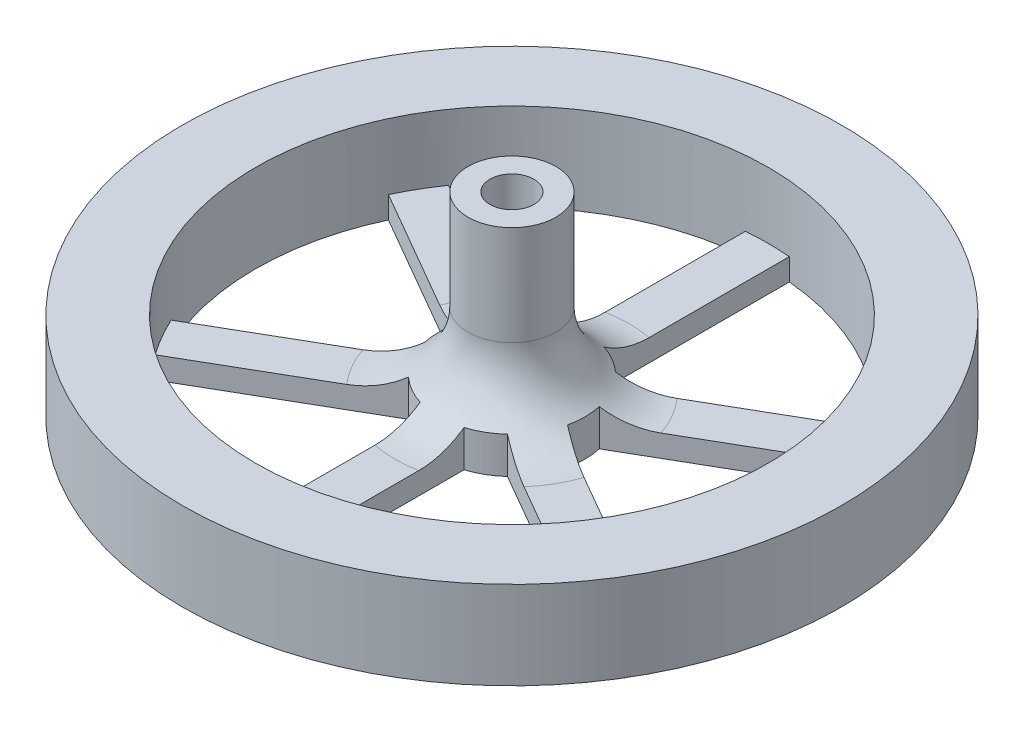
from build123d import *

# Parameters (mm, degrees)
SKETCH2_R           = 45
SKETCH2_R_2         = 35
BOSS_EXTRUDE1_DEPTH = 12
BOSS_EXTRUDE2_DEPTH = 3
CIRPATTERN1_COUNT   = 6
SKETCH4_R           = 6
SKETCH4_R_2         = 3
BOSS_EXTRUDE3_DEPTH = 23.6
FILLET1_R           = 10


with BuildPart() as part:
    # Sketch2 → Boss-Extrude1 (new body)
    with BuildSketch(Plane(origin=(0, 0, 0), x_dir=(1, 0, 0), z_dir=(0, 1, 0))):
        with Locations(Location((0, 0, 0), (0, 0, 270))):
            Circle(SKETCH2_R)
        with Locations(Location((0, 0, 0), (0, 0, 270))):
            Circle(SKETCH2_R_2, mode=Mode.SUBTRACT)
    extrude(amount=BOSS_EXTRUDE1_DEPTH)

    # Sketch3 → Boss-Extrude2 (add)
    with BuildSketch(Plane.XZ):
        with BuildLine():
            Line((-3, 40.114762923), (3, 40.114762923))
            Line((3, 40.114762923), (3, 9.539392014))
            ThreePointArc((3, 9.539392014), (0, -10), (-3, 9.539392014))
            Line((-3, 9.539392014), (-3, 40.114762923))
        make_face()
    boss_extrude2 = extrude(amount=-BOSS_EXTRUDE2_DEPTH)

    # CirPattern1: Boss-Extrude2 ×6 about axis
    cirpattern1_axis = Axis((0, 0, 0), (0, 1, 0))
    for i in range(1, CIRPATTERN1_COUNT):
        add(boss_extrude2.rotate(cirpattern1_axis, i * 360 / CIRPATTERN1_COUNT))

    # Sketch4 → Boss-Extrude3 (add)
    with BuildSketch(Plane(origin=(0, 3, 0), x_dir=(1, 0, 0), z_dir=(0, 1, 0))):
        with Locations(Location((0, 0, 0), (0, 0, 90))):
            Circle(SKETCH4_R)
        with Locations(Location((0, 0, 0), (0, 0, 270))):
            Circle(SKETCH4_R_2, mode=Mode.SUBTRACT)
    extrude(amount=BOSS_EXTRUDE3_DEPTH)

    # Fillet1
    # the kernel refuses this fillet: 10 mm, written as the material it adds along each edge
    with BuildSketch(Plane(origin=(0, 3, 0), x_dir=(0, 0, -1), z_dir=(1, 0, 0))) as fillet1_piece_1_section:
        with BuildLine():
            CenterArc((6 + FILLET1_R, FILLET1_R), FILLET1_R, 180, 90)
            Line((6, FILLET1_R), (6, 0))
            Line((6, 0), (6 + FILLET1_R, 0))
        make_face()
    fillet1_piece_1 = revolve(axis=Axis((0, 3, 0), (0, 1, 0)), mode=Mode.PRIVATE)
    fillet1_piece_1 = split(fillet1_piece_1, bisect_by=Plane(origin=(3, 3.588688927, -11.330954683), z_dir=(-1, 0, 0)), keep=Keep.TOP, mode=Mode.PRIVATE)
    fillet1_piece_1 = split(fillet1_piece_1, bisect_by=Plane(origin=(-3, 3.588688927, -11.330954683), z_dir=(1, 0, 0)), keep=Keep.TOP, mode=Mode.PRIVATE)
    add(fillet1_piece_1)
    with BuildSketch(Plane(origin=(0, 3, 0), x_dir=(0, 0, -1), z_dir=(1, 0, 0))) as fillet1_piece_2_section:
        with BuildLine():
            CenterArc((6 + FILLET1_R, FILLET1_R), FILLET1_R, 180, 90)
            Line((6, FILLET1_R), (6, 0))
            Line((6, 0), (6 + FILLET1_R, 0))
        make_face()
    fillet1_piece_2 = revolve(axis=Axis((0, 3, 0), (0, 1, 0)), mode=Mode.PRIVATE)
    fillet1_piece_2 = fillet1_piece_2 & Plane(origin=(0, 4.321014417, 0), x_dir=(0.2999999999999998, 0, 0.9539392014169458), z_dir=(0, -1, 0)) * Cylinder(10, 64, mode=Mode.PRIVATE)
    add(fillet1_piece_2)
    with BuildSketch(Plane(origin=(0, 3, 0), x_dir=(0, 0, -1), z_dir=(1, 0, 0))) as fillet1_piece_3_section:
        with BuildLine():
            CenterArc((6 + FILLET1_R, FILLET1_R), FILLET1_R, 180, 90)
            Line((6, FILLET1_R), (6, 0))
            Line((6, 0), (6 + FILLET1_R, 0))
        make_face()
    fillet1_piece_3 = revolve(axis=Axis((0, 3, 0), (0, 1, 0)), mode=Mode.PRIVATE)
    fillet1_piece_3 = split(fillet1_piece_3, bisect_by=Plane(origin=(-11.312894604, 3.588688928, -3.06740113), z_dir=(0.5000000000000002, 0, -0.8660254037844386)), keep=Keep.TOP, mode=Mode.PRIVATE)
    fillet1_piece_3 = split(fillet1_piece_3, bisect_by=Plane(origin=(-8.312894604, 3.588688928, -8.263553553), z_dir=(-0.5000000000000001, 0, 0.8660254037844387)), keep=Keep.TOP, mode=Mode.PRIVATE)
    add(fillet1_piece_3)
    with BuildSketch(Plane(origin=(0, 3, 0), x_dir=(0, 0, -1), z_dir=(1, 0, 0))) as fillet1_piece_4_section:
        with BuildLine():
            CenterArc((6 + FILLET1_R, FILLET1_R), FILLET1_R, 180, 90)
            Line((6, FILLET1_R), (6, 0))
            Line((6, 0), (6 + FILLET1_R, 0))
        make_face()
    fillet1_piece_4 = revolve(axis=Axis((0, 3, 0), (0, 1, 0)), mode=Mode.PRIVATE)
    fillet1_piece_4 = split(fillet1_piece_4, bisect_by=Plane(origin=(11.312894604, 3.588688928, -3.06740113), z_dir=(-0.4999999999999998, 0, -0.8660254037844388)), keep=Keep.TOP, mode=Mode.PRIVATE)
    fillet1_piece_4 = split(fillet1_piece_4, bisect_by=Plane(origin=(8.312894604, 3.588688928, -8.263553553), z_dir=(0.49999999999999994, 0, 0.8660254037844389)), keep=Keep.TOP, mode=Mode.PRIVATE)
    add(fillet1_piece_4)


solid = part.part
